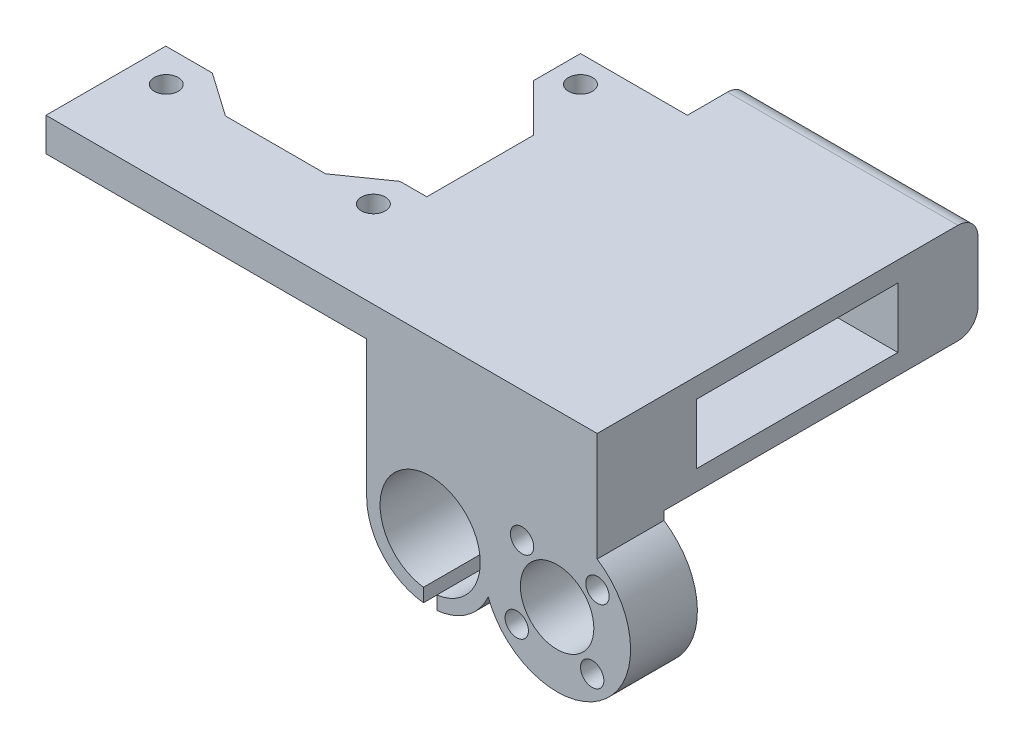
from build123d import *

# Parameters (mm, degrees)
SKETCH1_R               = 1.8
BOSS_EXTRUDE1_DEPTH     = 35
CUT_EXTRUDE1_DEPTH      = 20
FILLET1_R               = 3
CUT_EXTRUDE2_DEPTH      = 102.662431606
CUT_EXTRUDE2_DEPTH_BACK = 102.662431606
SKETCH5_W               = 48
SKETCH5_H               = 48
CUT_EXTRUDE3_DEPTH      = 30
SKETCH6_W               = 30.142
SKETCH6_H               = 9
CUT_EXTRUDE4_DEPTH      = 31.4
SKETCH7_W               = 21
SKETCH7_H               = 9
CUT_EXTRUDE5_DEPTH      = 85.173689476
SKETCH8_R               = 3.5
CUT_EXTRUDE6_DEPTH      = 1.5
SKETCH11_R              = 1.75
SKETCH11_R_2            = 5.5
BOSS_EXTRUDE3_DEPTH     = 10


with BuildPart() as part:
    # Sketch1 → Boss-Extrude1 (new body)
    with BuildSketch(Plane(origin=(0, 0, 0), x_dir=(1, 0, 0), z_dir=(0, 1, 0))):
        Polygon((0, 17.928932188), (0, 0), (82.5, 0), (82.5, 57), (48, 57), (48, 48), (32, 48), (32, 41), (39.071067812, 33.928932188), (39.071067812, 17.928932188), (35.071067812, 17.928932188), (28.517851458, 13.340320697), (13.517851458, 13.340320697), (6.964635103, 17.928932188), align=None)
        with Locations((5, 13)):
            Circle(SKETCH1_R, mode=Mode.SUBTRACT)
        with Locations((36, 13)):
            Circle(SKETCH1_R, mode=Mode.SUBTRACT)
        with Locations((36, 44)):
            Circle(SKETCH1_R, mode=Mode.SUBTRACT)
    extrude(amount=BOSS_EXTRUDE1_DEPTH)

    # Sketch2 → Cut-Extrude1 (cut)
    with BuildSketch(Plane.XZ):
        Polygon((82.5, -57), (82.5, 0), (67, 0), (67, -48), (48, -48), (48, -57), align=None)
    extrude(amount=-CUT_EXTRUDE1_DEPTH, mode=Mode.SUBTRACT)

    # Fillet1
    fillet1_edges = [part.edges().sort_by_distance(p)[0] for p in [
        (65.25, 35, -57),
        (65.25, 20, -57),
    ]]
    fillet(fillet1_edges, radius=FILLET1_R)

    # Sketch3 → Cut-Extrude2 (cut, two sides: drawn at the far end of the back side and taken through both)
    with BuildSketch(Plane(origin=(0, 0, -48), x_dir=(-1, 0, 0), z_dir=(0, 0, -1)).offset(-CUT_EXTRUDE2_DEPTH_BACK)):
        with BuildLine():
            Line((-56.5, 0.052778186), (-56.5, 2.066965626))
            ThreePointArc((-56.5, 2.066965626), (-57.5, 17), (-58.5, 2.066965626))
            Line((-58.5, 2.066965626), (-58.5, 0.052778186))
            ThreePointArc((-58.5, 0.052778186), (-64.562223446, 3.145867486), (-67, 9.5))
            Line((-67, 9.5), (-67, 0))
            Line((-67, 0), (-48, 0))
            Line((-48, 0), (-48, 9.5))
            ThreePointArc((-48, 9.5), (-50.437776554, 3.145867486), (-56.5, 0.052778186))
        make_face()
    extrude(amount=CUT_EXTRUDE2_DEPTH + CUT_EXTRUDE2_DEPTH_BACK, mode=Mode.SUBTRACT)

    # Sketch5 → Cut-Extrude3 (cut)
    with BuildSketch(Plane.XZ):
        with Locations((24, -24)):
            Rectangle(SKETCH5_W, SKETCH5_H)
    extrude(amount=-CUT_EXTRUDE3_DEPTH, mode=Mode.SUBTRACT)

    # Sketch6 → Cut-Extrude4 (cut)
    with BuildSketch(Plane(origin=(82.5, 0, 0), x_dir=(0, 0, -1), z_dir=(1, 0, 0))):
        with Locations((29.929, 27.5)):
            Rectangle(SKETCH6_W, SKETCH6_H)
    extrude(amount=-CUT_EXTRUDE4_DEPTH, mode=Mode.SUBTRACT)

    # Sketch7 → Cut-Extrude5 (cut, through all)
    with BuildSketch(Plane(origin=(51.1, 0, 0), x_dir=(0, 0, -1), z_dir=(1, 0, 0))):
        with Locations((28.428932188, 27.5)):
            Rectangle(SKETCH7_W, SKETCH7_H)
    extrude(amount=-CUT_EXTRUDE5_DEPTH, mode=Mode.SUBTRACT)

    # Sketch8 → Cut-Extrude6 (cut)
    with BuildSketch(Plane.XZ.offset(-30)):
        with Locations((5, -13)):
            Circle(SKETCH8_R)
        with Locations((36, -13)):
            Circle(SKETCH8_R)
        with Locations((36, -44)):
            Circle(SKETCH8_R)
    extrude(amount=-CUT_EXTRUDE6_DEPTH, mode=Mode.SUBTRACT)

    # Sketch11 → Boss-Extrude3 (add)
    with BuildSketch(Plane.XY):
        with BuildLine():
            Line((67, 20), (67, 9.5))
            ThreePointArc((67, 9.5), (66.795496221, 7.539451607), (66.190789474, 5.663311542))
            ThreePointArc((66.190789474, 5.663311542), (83.374491132, 0.912720357), (82.5, 18.719544457))
            Line((82.5, 18.719544457), (82.5, 20))
            Line((82.5, 20), (67, 20))
        make_face()
        with Locations((82.537676642, 14.748472232)):
            Circle(SKETCH11_R, mode=Mode.SUBTRACT)
        with Locations((70.462323358, 4.251527768)):
            Circle(SKETCH11_R, mode=Mode.SUBTRACT)
        with Locations((81.748472232, 3.462323358)):
            Circle(SKETCH11_R, mode=Mode.SUBTRACT)
        with Locations((76.5, 9.5)):
            Circle(SKETCH11_R_2, mode=Mode.SUBTRACT)
        with Locations((71.251527768, 15.537676642)):
            Circle(SKETCH11_R, mode=Mode.SUBTRACT)
    extrude(amount=-BOSS_EXTRUDE3_DEPTH)


solid = part.part
